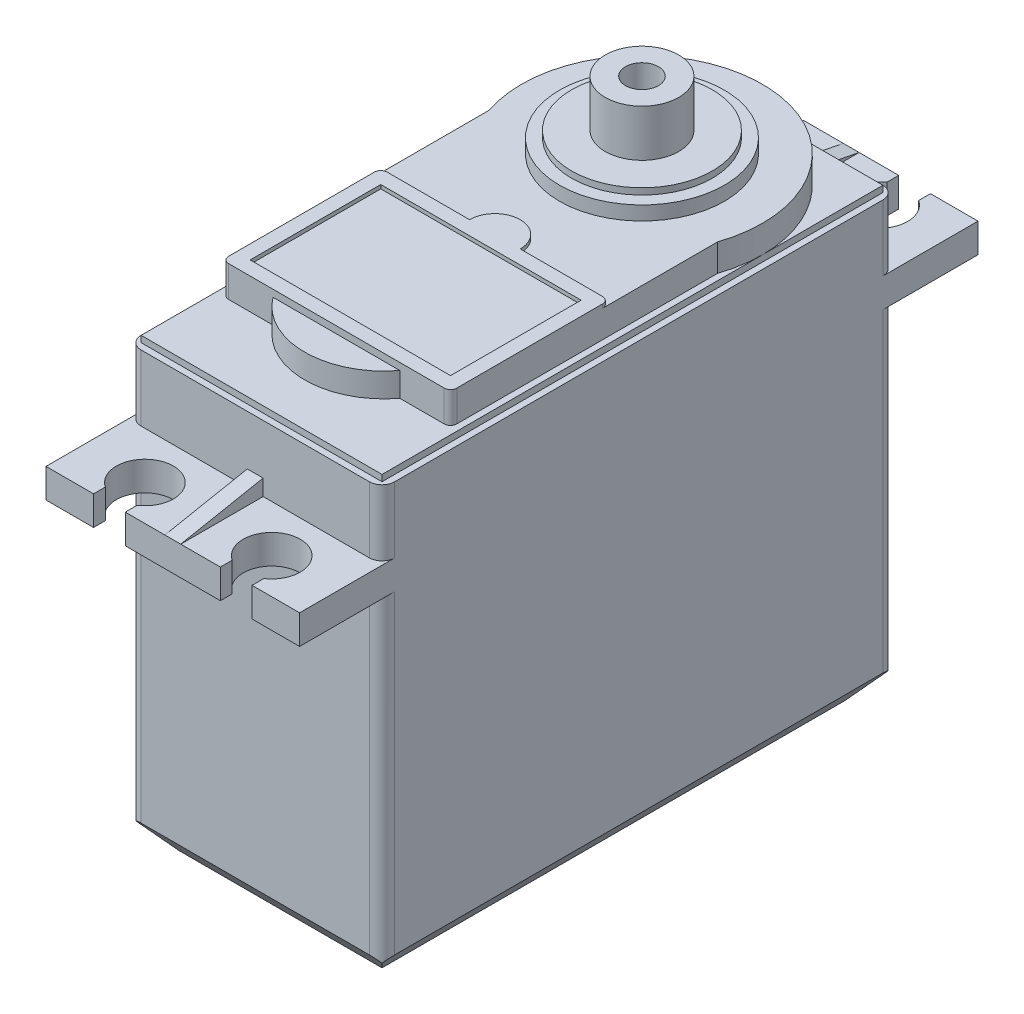
from build123d import *

# Parameters (mm, degrees)
SKETCH1_W           = 20
SKETCH1_H           = 40.5
BOSS_EXTRUDE1_DEPTH = 35.2
CHAMFER1_SIZE       = 2
CHAMFER1_SIZE2      = 2.383507185
BOSS_EXTRUDE2_DEPTH = 2.3
SKETCH3_W           = 1.25
SKETCH3_H           = 6.5
BOSS_EXTRUDE3_DEPTH = 1.3
CHAMFER2_SIZE       = 6.687920221
CHAMFER2_SIZE_2     = 1.3
SKETCH5_OUTSIDE_W   = 35.418
SKETCH5_OUTSIDE_H   = 68.918
SKETCH5_OUTSIDE_W_2 = 19
SKETCH5_OUTSIDE_H_2 = 39.5
CUT_EXTRUDE1_DEPTH  = 0.5
BOSS_EXTRUDE4_DEPTH = 2.15
BOSS_EXTRUDE5_DEPTH = 1.9
SKETCH8_R           = 6.5
BOSS_EXTRUDE6_DEPTH = 1.1
SKETCH9_R           = 5.55
BOSS_EXTRUDE7_DEPTH = 0.5
SKETCH10_R          = 2.9
SKETCH10_R_2        = 1.3
BOSS_EXTRUDE8_DEPTH = 3.7
SKETCH11_W          = 15.8
SKETCH11_H          = 10.3
BOSS_EXTRUDE9_DEPTH = 0.3
FILLET1_R           = 0.5
FILLET2_R           = 1


with BuildPart() as part:
    # Sketch1 → Boss-Extrude1 (new body)
    with BuildSketch(Plane(origin=(0, 0, 0), x_dir=(1, 0, 0), z_dir=(0, 1, 0))):
        with Locations((0, -10.25)):
            Rectangle(SKETCH1_W, SKETCH1_H)
    extrude(amount=BOSS_EXTRUDE1_DEPTH)

    # Chamfer1
    chamfer1_edges = [part.edges().sort_by_distance(p)[0] for p in [
        (0, 0, 30.5),
        (-10, 0, 10.25),
        (0, 0, -10),
        (10, 0, 10.25),
    ]]
    chamfer1_side = [part.faces().sort_by_distance(p)[0] for p in [
        (0, 0, 10.25),
    ]]
    chamfer(chamfer1_edges, length=CHAMFER1_SIZE, length2=CHAMFER1_SIZE2, reference=chamfer1_side[0])

    # Sketch2 → Boss-Extrude2 (add)
    with BuildSketch(Plane(origin=(0, 27.2, 0), x_dir=(-1, 0, 0), z_dir=(0, 1, 0))):
        with BuildLine():
            Line((10, -10), (-10, -10))
            Line((-10, -10), (-10, -16.5))
            Line((-10, -16.5), (-6.25, -16.5))
            Line((-6.25, -16.5), (-6.25, -15.570828693))
            ThreePointArc((-6.25, -15.570828693), (-5, -11.45), (-3.75, -15.570828693))
            Line((-3.75, -15.570828693), (-3.75, -16.5))
            Line((-3.75, -16.5), (3.75, -16.5))
            Line((3.75, -16.5), (3.75, -15.570828693))
            ThreePointArc((3.75, -15.570828693), (5, -11.45), (6.25, -15.570828693))
            Line((6.25, -15.570828693), (6.25, -16.5))
            Line((6.25, -16.5), (10, -16.5))
            Line((10, -16.5), (10, -10))
        make_face()
        with BuildLine():
            Line((-6.25, 37), (-10, 37))
            Line((-10, 37), (-10, 30.5))
            Line((-10, 30.5), (10, 30.5))
            Line((10, 30.5), (10, 37))
            Line((10, 37), (6.25, 37))
            Line((6.25, 37), (6.25, 36.070828693))
            ThreePointArc((6.25, 36.070828693), (5, 31.95), (3.75, 36.070828693))
            Line((3.75, 36.070828693), (3.75, 37))
            Line((3.75, 37), (-3.75, 37))
            Line((-3.75, 37), (-3.75, 36.070828693))
            ThreePointArc((-3.75, 36.070828693), (-5, 31.95), (-6.25, 36.070828693))
            Line((-6.25, 36.070828693), (-6.25, 37))
        make_face()
    extrude(amount=BOSS_EXTRUDE2_DEPTH)

    # Sketch3 → Boss-Extrude3 (add)
    with BuildSketch(Plane(origin=(0, 29.5, 0), x_dir=(1, 0, 0), z_dir=(0, 1, 0))):
        with Locations((0, -33.75)):
            Rectangle(SKETCH3_W, SKETCH3_H)
        with Locations((0, 13.25)):
            Rectangle(SKETCH3_W, SKETCH3_H)
    extrude(amount=BOSS_EXTRUDE3_DEPTH)

    # Chamfer2
    # the kernel refuses this chamfer: 6.687920221, 1.3 mm, written as the material it takes off along each edge
    with BuildSketch(Plane(origin=(-18.001773564, 30.8, 37), x_dir=(0, 0.007343799087842576, -0.9999730339438946), z_dir=(1, 0, 0))) as chamfer2_piece_1_section:
        Polygon((CHAMFER2_SIZE * 0.999973033908, -CHAMFER2_SIZE * 0.00734379908758), (-CHAMFER2_SIZE_2 * 0.00734379908784, -CHAMFER2_SIZE_2 * 0.999973033944), (0, 0), align=None)
    chamfer2_piece_1 = extrude(amount=36.003547128, mode=Mode.PRIVATE)
    chamfer2_piece_1 = split(chamfer2_piece_1, bisect_by=Plane(origin=(0, 30.433956973, 30.5), z_dir=(0, 0, 1)), keep=Keep.TOP, mode=Mode.PRIVATE)
    add(chamfer2_piece_1, mode=Mode.SUBTRACT)
    with BuildSketch(Plane(origin=(18.001773564, 30.8, -16.5), x_dir=(0, -0.9816291836389949, -0.19079870499623547), z_dir=(-1, 0, 0))) as chamfer2_piece_2_section:
        Polygon((CHAMFER2_SIZE_2 * 0.981629183639, CHAMFER2_SIZE_2 * 0.190798704996), (-CHAMFER2_SIZE * 0.190798704989, CHAMFER2_SIZE * 0.981629183604), (0, 0), align=None)
    chamfer2_piece_2 = extrude(amount=36.003547128, mode=Mode.PRIVATE)
    chamfer2_piece_2 = split(chamfer2_piece_2, bisect_by=Plane(origin=(0, 30.433956973, -10), z_dir=(0, 0, -1)), keep=Keep.TOP, mode=Mode.PRIVATE)
    add(chamfer2_piece_2, mode=Mode.SUBTRACT)

    # Sketch5 outside → Cut-Extrude1 (cut)
    with BuildSketch(Plane(origin=(0, 35.2, 0), x_dir=(1, 0, 0), z_dir=(0, 1, 0))):
        with Locations((0, -10.25)):
            Rectangle(SKETCH5_OUTSIDE_W, SKETCH5_OUTSIDE_H)
        with Locations((0, -10.25)):
            Rectangle(SKETCH5_OUTSIDE_W_2, SKETCH5_OUTSIDE_H_2, mode=Mode.SUBTRACT)
    extrude(amount=-CUT_EXTRUDE1_DEPTH, mode=Mode.SUBTRACT)

    # Sketch6 → Boss-Extrude4 (add)
    with BuildSketch(Plane(origin=(0, 35.2, 0), x_dir=(1, 0, 0), z_dir=(0, 1, 0))):
        with BuildLine():
            Line((-9, -3.041381265), (-9, -24.1))
            Line((-9, -24.1), (9, -24.1))
            Line((9, -24.1), (9, -3.041381265))
            ThreePointArc((9, -3.041381265), (0, 9.5), (-9, -3.041381265))
        make_face()
    extrude(amount=BOSS_EXTRUDE4_DEPTH)

    # Sketch7 → Boss-Extrude5 (add)
    with BuildSketch(Plane(origin=(0, 35.2, 0), x_dir=(1, 0, 0), z_dir=(0, 1, 0))):
        with BuildLine():
            Line((-5, -24.1), (5, -24.1))
            ThreePointArc((5, -24.1), (0, -26.6), (-5, -24.1))
        make_face()
    extrude(amount=BOSS_EXTRUDE5_DEPTH)

    # Sketch8 → Boss-Extrude6 (add)
    with BuildSketch(Plane(origin=(0, 37.35, 0), x_dir=(1, 0, 0), z_dir=(0, 1, 0))):
        with Locations(Location((0, 0, 0), (0, 0, 270))):
            Circle(SKETCH8_R)
    extrude(amount=BOSS_EXTRUDE6_DEPTH)

    # Sketch9 → Boss-Extrude7 (add)
    with BuildSketch(Plane(origin=(0, 38.45, 0), x_dir=(1, 0, 0), z_dir=(0, 1, 0))):
        with Locations(Location((0, 0, 0), (0, 0, 270))):
            Circle(SKETCH9_R)
    extrude(amount=BOSS_EXTRUDE7_DEPTH)

    # Sketch10 → Boss-Extrude8 (add)
    with BuildSketch(Plane(origin=(0, 38.95, 0), x_dir=(1, 0, 0), z_dir=(0, 1, 0))):
        with Locations(Location((0, 0, 0), (0, 0, 270))):
            Circle(SKETCH10_R)
        with Locations(Location((0, 0, 0), (0, 0, 270))):
            Circle(SKETCH10_R_2, mode=Mode.SUBTRACT)
    extrude(amount=BOSS_EXTRUDE8_DEPTH)

    # Sketch11 → Boss-Extrude9 (add)
    with BuildSketch(Plane(origin=(0, 37.35, 0), x_dir=(1, 0, 0), z_dir=(0, 1, 0))):
        with BuildLine():
            Line((-9, -24.1), (9, -24.1))
            Line((9, -24.1), (9, -11.6))
            Line((9, -11.6), (2, -11.6))
            ThreePointArc((2, -11.6), (0, -9.6), (-2, -11.6))
            Line((-2, -11.6), (-9, -11.6))
            Line((-9, -11.6), (-9, -24.1))
        make_face()
        with Locations((0, -17.85)):
            Rectangle(SKETCH11_W, SKETCH11_H, mode=Mode.SUBTRACT)
    extrude(amount=BOSS_EXTRUDE9_DEPTH)

    # Fillet1
    fillet1_edges = [part.edges().sort_by_distance(p)[0] for p in [
        (-9, 36.425, 24.1),
        (9, 36.425, 24.1),
        (-9, 37.5, 11.6),
        (9, 37.5, 11.6),
    ]]
    fillet(fillet1_edges, radius=FILLET1_R)

    # Fillet2
    fillet2_edges = [part.edges().sort_by_distance(p)[0] for p in [
        (10, 14.791753593, -10),
        (10, 32.1, -10),
        (10, 32.1, 30.5),
        (10, 14.791753593, 30.5),
        (-10, 32.1, 30.5),
        (-10, 14.791753593, 30.5),
        (-10, 14.791753593, -10),
        (-10, 32.1, -10),
    ]]
    fillet(fillet2_edges, radius=FILLET2_R)


solid = part.part
